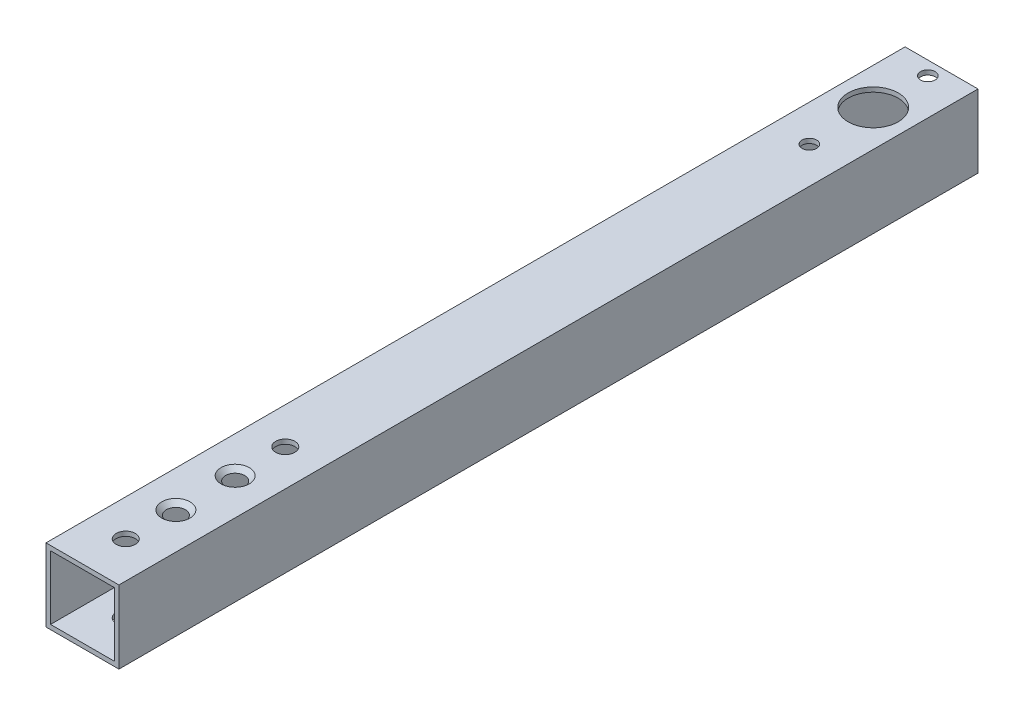
from build123d import *

# Parameters (mm, degrees)
BOSS_EXTRUDE1_DEPTH      = 125
BOSS_EXTRUDE1_DEPTH_BACK = 63.5
SKETCH1_W                = 16
SKETCH1_H                = 16
SKETCH1_W_2              = 14
SKETCH1_H_2              = 14
SKETCH2_R                = 2.1
SKETCH2_R_2              = 1.6
SKETCH2_R_3              = 5.5
CUT_EXTRUDE1_DEPTH       = 127.273512662
CHAMFER1_SIZE            = 1.5


with BuildPart() as part:
    # Sketch1 → Boss-Extrude1 (new, two sides: drawn at the far end of the back side and taken through both)
    with BuildSketch(Plane.XY.offset(-BOSS_EXTRUDE1_DEPTH_BACK)):
        Rectangle(SKETCH1_W, SKETCH1_H)
        Rectangle(SKETCH1_W_2, SKETCH1_H_2, mode=Mode.SUBTRACT)
    extrude(amount=BOSS_EXTRUDE1_DEPTH + BOSS_EXTRUDE1_DEPTH_BACK)

    # Sketch2 → Cut-Extrude1 (cut, through all)
    with BuildSketch(Plane(origin=(0, 8, 0), x_dir=(1, 0, 0), z_dir=(0, 1, 0))):
        with Locations(Location((0, -115.5, 0), (0, 0, 270))):
            Circle(SKETCH2_R)
        with Locations(Location((0, -104.5, 0), (0, 0, 270))):
            Circle(SKETCH2_R_2)
        with Locations(Location((0, 48.5, 0), (0, 0, 270))):
            Circle(SKETCH2_R_3)
        with Locations(Location((0, 60.5, 0), (0, 0, 270))):
            Circle(SKETCH2_R_2)
        with Locations(Location((0, 34.5, 0), (0, 0, 270))):
            Circle(SKETCH2_R_2)
        with Locations(Location((0, -80.5, 0), (0, 0, 270))):
            Circle(SKETCH2_R)
        with Locations(Location((0, -91.5, 0), (0, 0, 270))):
            Circle(SKETCH2_R_2)
    extrude(amount=-CUT_EXTRUDE1_DEPTH, mode=Mode.SUBTRACT)

    # Chamfer1
    # the kernel refuses this chamfer: 1.5 mm, written as the material it takes off along each edge
    with BuildSketch(Plane(origin=(0, 8, 104.5), x_dir=(0, 0, 1), z_dir=(-1, 0, 0))) as chamfer1_piece_1:
        Polygon((1.6 + CHAMFER1_SIZE, 0), (1.6, -CHAMFER1_SIZE), (1.6, 0), align=None)
    revolve(axis=Axis((0, 8, 104.5), (0, 1, 0)), mode=Mode.SUBTRACT)
    with BuildSketch(Plane(origin=(0, 8, 91.5), x_dir=(0, 0, 1), z_dir=(-1, 0, 0))) as chamfer1_piece_2:
        Polygon((1.6 + CHAMFER1_SIZE, 0), (1.6, -CHAMFER1_SIZE), (1.6, 0), align=None)
    revolve(axis=Axis((0, 8, 91.5), (0, 1, 0)), mode=Mode.SUBTRACT)
    with BuildSketch(Plane(origin=(0, -8, 104.5), x_dir=(0, 0, 1), z_dir=(-1, 0, 0))) as chamfer1_piece_3:
        Polygon((1.6 + CHAMFER1_SIZE, 0), (1.6, CHAMFER1_SIZE), (1.6, 0), align=None)
    revolve(axis=Axis((0, -8, 104.5), (0, 1, 0)), mode=Mode.SUBTRACT)
    with BuildSketch(Plane(origin=(0, -8, 91.5), x_dir=(0, 0, 1), z_dir=(-1, 0, 0))) as chamfer1_piece_4:
        Polygon((1.6 + CHAMFER1_SIZE, 0), (1.6, CHAMFER1_SIZE), (1.6, 0), align=None)
    revolve(axis=Axis((0, -8, 91.5), (0, 1, 0)), mode=Mode.SUBTRACT)


solid = part.part
